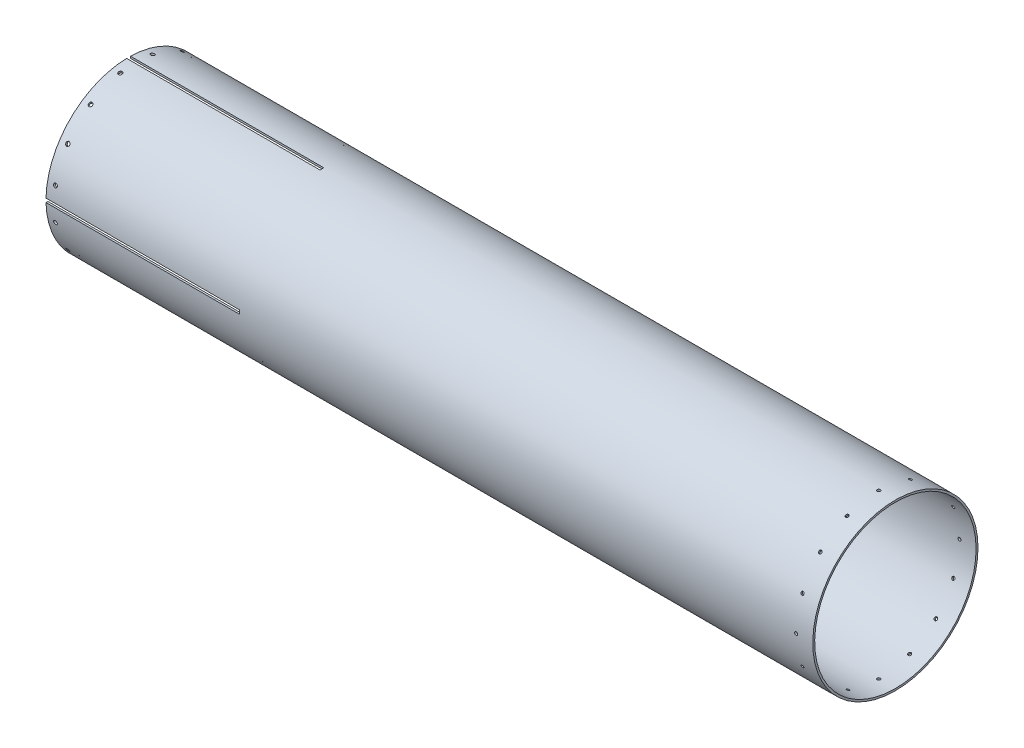
from build123d import *

# Parameters (mm, degrees)
SZKIC1_R                    = 87
SZKIC1_R_2                  = 85
DODANIE_WYCI_GNI_CIE1_DEPTH = 807.51
WYTNIJ_WYCI_GNI_CIE1_DEPTH  = 203.6
SZKIC4_R                    = 2
WYTNIJ_WYCI_GNI_CIE2_DEPTH  = 61.6
SZYK_KO_OWY1_COUNT          = 16
SZKIC6_R                    = 1.6
WYTNIJ_WYCI_GNI_CIE3_DEPTH  = 61.6
SZYK_KO_OWY3_COUNT          = 16


with BuildPart() as part:
    # Szkic1 → Dodanie-wyciągnięcie1 (new body)
    with BuildSketch(Plane(origin=(0, 0, 0), x_dir=(0, 0, -1), z_dir=(1, 0, 0))):
        Circle(SZKIC1_R)
        Circle(SZKIC1_R_2, mode=Mode.SUBTRACT)
    extrude(amount=DODANIE_WYCI_GNI_CIE1_DEPTH)

    # Szkic2 → Wytnij-wyciągnięcie1 (cut)
    with BuildSketch(Plane(origin=(0, 0, 0), x_dir=(0, 0, -1), z_dir=(1, 0, 0))):
        with BuildLine():
            Line((-86.977008456, -2), (-2, -2))
            Line((-2, -2), (-2, -86.977008456))
            ThreePointArc((-2, -86.977008456), (0, -87), (2, -86.977008456))
            Line((2, -86.977008456), (2, -2))
            Line((2, -2), (86.977008456, -2))
            ThreePointArc((86.977008456, -2), (87, 0), (86.977008456, 2))
            Line((86.977008456, 2), (2, 2))
            Line((2, 2), (2, 86.977008456))
            ThreePointArc((2, 86.977008456), (0, 87), (-2, 86.977008456))
            Line((-2, 86.977008456), (-2, 2))
            Line((-2, 2), (-86.977008456, 2))
            ThreePointArc((-86.977008456, 2), (-87, 0), (-86.977008456, -2))
        make_face()
    extrude(amount=WYTNIJ_WYCI_GNI_CIE1_DEPTH, mode=Mode.SUBTRACT)

    # Szkic4 → Wytnij-wyciągnięcie2 (cut)
    with BuildSketch(Plane(origin=(0, 85.328319395, 16.972858015), x_dir=(1, 0, 0), z_dir=(0, 0.9807852804032319, 0.19509032201612145))):
        with Locations((8.35, 0)):
            Circle(SZKIC4_R)
    wytnij_wyci_gni_cie2 = extrude(amount=-WYTNIJ_WYCI_GNI_CIE2_DEPTH, mode=Mode.SUBTRACT)

    # Szyk kołowy1: Wytnij-wyciągnięcie2 ×16 about axis
    szyk_ko_owy1_axis = Axis((807.51, 0, 0), (-1, 0, 0))
    for i in range(1, SZYK_KO_OWY1_COUNT):
        add(wytnij_wyci_gni_cie2.rotate(szyk_ko_owy1_axis, i * 360 / SZYK_KO_OWY1_COUNT), mode=Mode.SUBTRACT)

    # Szkic6 → Wytnij-wyciągnięcie3 (cut)
    with BuildSketch(Plane(origin=(0, 87, 0), x_dir=(1, 0, 0), z_dir=(0, 1, 0))):
        with Locations((790.01, 0)):
            Circle(SZKIC6_R)
    wytnij_wyci_gni_cie3 = extrude(amount=-WYTNIJ_WYCI_GNI_CIE3_DEPTH, mode=Mode.SUBTRACT)

    # Szyk kołowy3: Wytnij-wyciągnięcie3 ×16 about axis
    szyk_ko_owy3_axis = Axis((807.51, 0, 0), (-1, 0, 0))
    for i in range(1, SZYK_KO_OWY3_COUNT):
        add(wytnij_wyci_gni_cie3.rotate(szyk_ko_owy3_axis, i * 360 / SZYK_KO_OWY3_COUNT), mode=Mode.SUBTRACT)


solid = part.part
